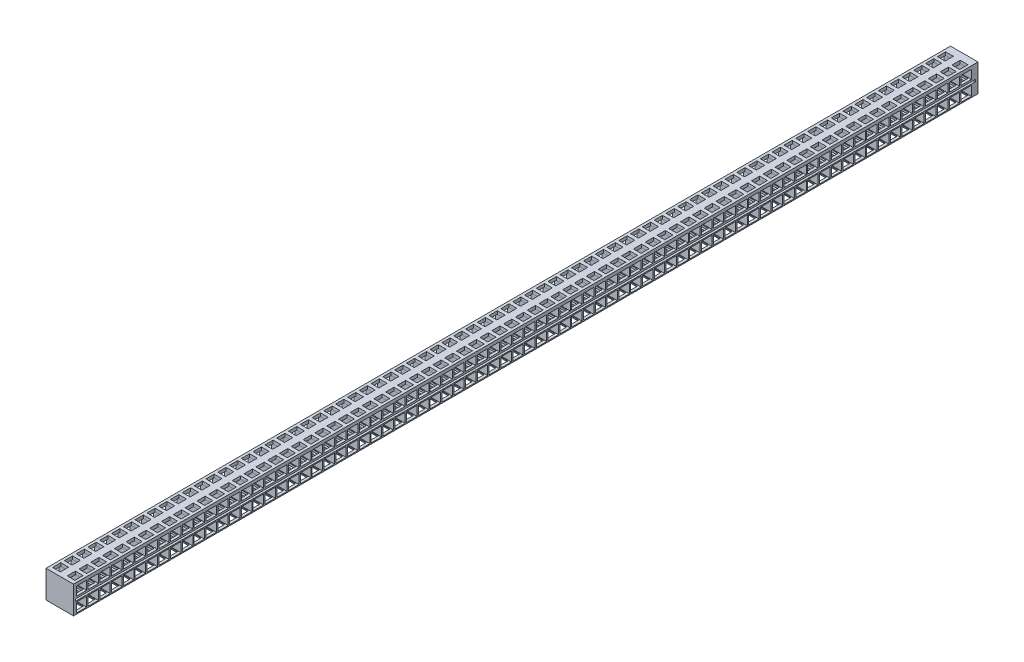
from build123d import *

# Parameters (mm, degrees)
CROQUIS1_W              = 350
CROQUIS1_H              = 350
SALIENTE_EXTRUIR1_DEPTH = 11500
CROQUIS2_W              = 11441.465552344
CROQUIS2_H              = 26.044376072
CORTAR_EXTRUIR1_DEPTH   = 11500
CROQUIS3_W              = 131.902149706
CROQUIS3_H              = 111.07549449
CROQUIS3_H_2            = 121.488822097
CORTAR_EXTRUIR2_DEPTH   = 11500
MATRIZL1_COUNT          = 76
MATRIZL1_PITCH          = 150
CROQUIS4_W              = 97.988334753
CROQUIS4_H              = 104.987501522
CROQUIS4_W_2            = 97.988334754
CORTAR_EXTRUIR3_DEPTH   = 11500
MATRIZL2_COUNT          = 76
MATRIZL2_PITCH          = 150


with BuildPart() as part:
    # Croquis1 → Saliente-Extruir1 (new body)
    with BuildSketch(Plane.XY):
        Rectangle(CROQUIS1_W, CROQUIS1_H)
    extrude(amount=SALIENTE_EXTRUIR1_DEPTH)

    # Croquis2 → Cortar-Extruir1 (cut)
    with BuildSketch(Plane(origin=(175, 0, 0), x_dir=(0, 0, -1), z_dir=(1, 0, 0))):
        with Locations((-5754.49044457, -13.022188036)):
            Rectangle(CROQUIS2_W, CROQUIS2_H)
    extrude(amount=-CORTAR_EXTRUIR1_DEPTH, mode=Mode.SUBTRACT)

    # Croquis3 → Cortar-Extruir2 (cut)
    with BuildSketch(Plane(origin=(175, 0, 0), x_dir=(0, 0, -1), z_dir=(1, 0, 0))):
        with Locations((-11399.414482837, 79.441219373)):
            Rectangle(CROQUIS3_W, CROQUIS3_H)
        with Locations((-11399.414482837, -101.056459172)):
            Rectangle(CROQUIS3_W, CROQUIS3_H_2)
    cortar_extruir2 = extrude(amount=-CORTAR_EXTRUIR2_DEPTH, mode=Mode.SUBTRACT)

    # MatrizL1: Cortar-Extruir2 ×76
    with Locations(*[(0, 0, -i * MATRIZL1_PITCH) for i in range(1, MATRIZL1_COUNT)]):
        add(cortar_extruir2, mode=Mode.SUBTRACT)

    # Croquis4 → Cortar-Extruir3 (cut)
    with BuildSketch(Plane(origin=(0, 175, 0), x_dir=(1, 0, 0), z_dir=(0, 1, 0))):
        with Locations((-92.947444509, -11396.992821556)):
            Rectangle(CROQUIS4_W, CROQUIS4_H)
        with Locations((92.530474847, -11396.992821556)):
            Rectangle(CROQUIS4_W_2, CROQUIS4_H)
    cortar_extruir3 = extrude(amount=-CORTAR_EXTRUIR3_DEPTH, mode=Mode.SUBTRACT)

    # MatrizL2: Cortar-Extruir3 ×76
    with Locations(*[(0, 0, -i * MATRIZL2_PITCH) for i in range(1, MATRIZL2_COUNT)]):
        add(cortar_extruir3, mode=Mode.SUBTRACT)


solid = part.part
